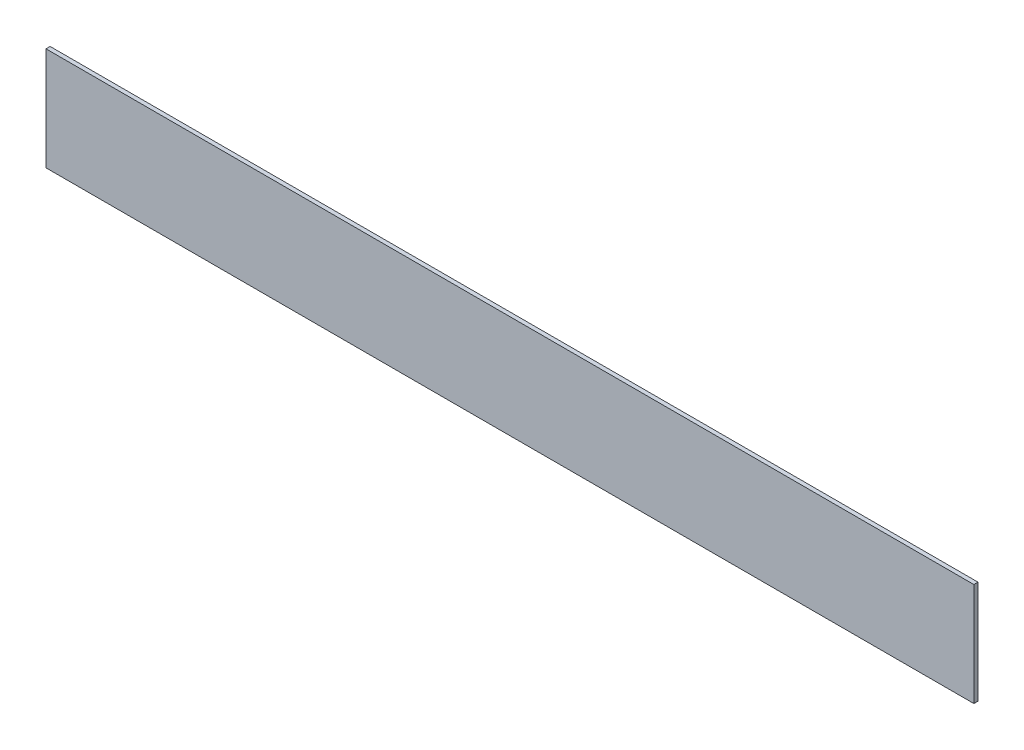
from build123d import *

# Parameters (mm, degrees)
SKETCH1_W           = 450
SKETCH1_H           = 50
BOSS_EXTRUDE1_DEPTH = 2


with BuildPart() as part:
    # Sketch1 → Boss-Extrude1 (new body)
    with BuildSketch(Plane.XY):
        Rectangle(SKETCH1_W, SKETCH1_H)
    extrude(amount=BOSS_EXTRUDE1_DEPTH)


solid = part.part
